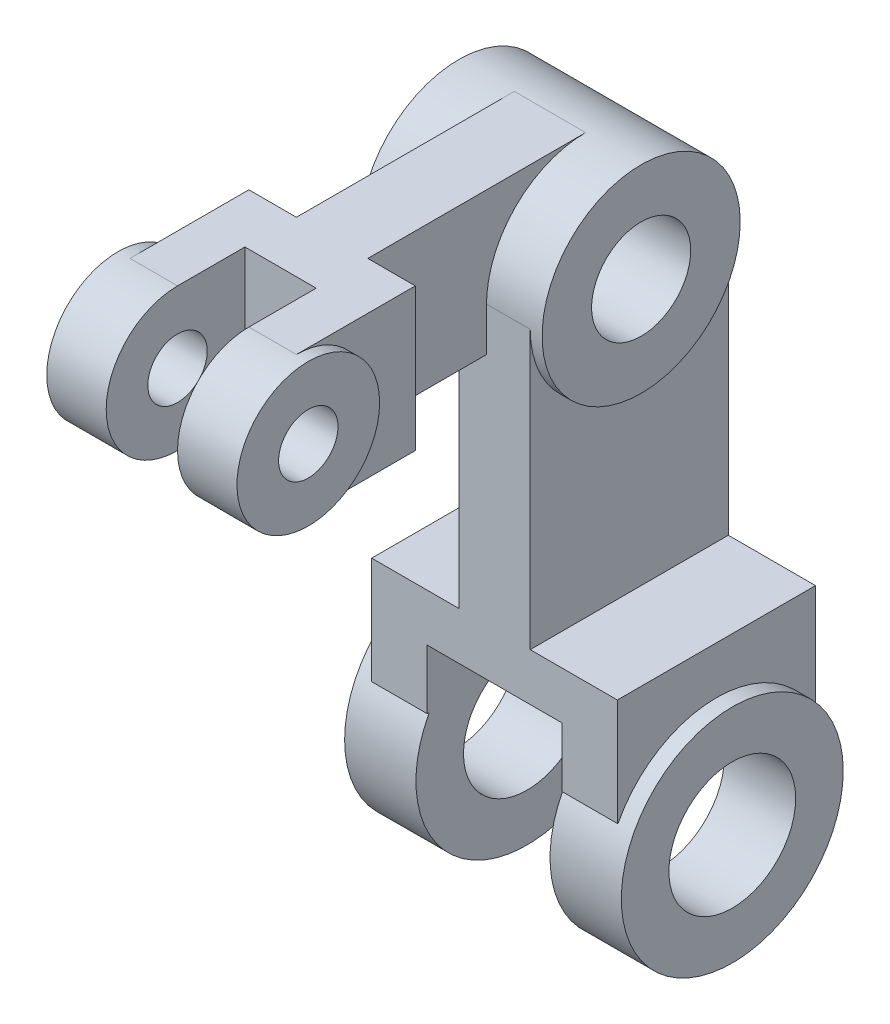
from build123d import *

# Parameters (mm, degrees)
BOSS_EXTRUDE1_DEPTH       = 50
BOSS_EXTRUDE7_START       = 15.277897686
BOSS_EXTRUDE7_OUTLINE_R   = 28
BOSS_EXTRUDE7_OUTLINE_R_2 = 16
BOSS_EXTRUDE7_DEPTH       = 18
CUT_EXTRUDE1_START        = -40
CUT_EXTRUDE1_DEPTH        = 40
BOSS_EXTRUDE8_START       = -36.722102314
BOSS_EXTRUDE8_OUTLINE_R   = 27.997706522
BOSS_EXTRUDE8_OUTLINE_R_2 = 16
BOSS_EXTRUDE8_DEPTH       = 18
CUT_EXTRUDE2_DEPTH        = 20
BOSS_EXTRUDE9_START       = -35.722102314
BOSS_EXTRUDE9_OUTLINE_R   = 25
BOSS_EXTRUDE9_OUTLINE_R_2 = 12.5
BOSS_EXTRUDE9_DEPTH       = 46
CUT_EXTRUDE3_START        = -18
CUT_EXTRUDE3_DEPTH        = 18
BOSS_EXTRUDE10_DEPTH      = 18
BOSS_EXTRUDE11_DEPTH      = 36
BOSS_EXTRUDE12_DEPTH      = 3
BOSS_EXTRUDE12_DEPTH_BACK = 11.999999999999996
SKETCH11_R                = 17.999999999999993
SKETCH11_R_2              = 7.499999999999997
BOSS_EXTRUDE13_DEPTH      = 3
BOSS_EXTRUDE13_DEPTH_BACK = 11.999999999999996
SKETCH12_R                = 18.000000000000018
SKETCH12_R_2              = 7.500000000000014
CUT_EXTRUDE6_DEPTH        = 107.00000000000003


# Read off the part's stored shape, not the designer's step: Boss-Extrude7, Boss-Extrude8, Boss-Extrude9
with BuildPart() as part:
    # Sketch1 → Boss-Extrude1 (new body)
    with BuildSketch(Plane.XY):
        Polygon((-10.722102313940692, 70), (7.2778976860593065, 70), (7.277897686059314, 0), (29.277897686059326, 0), (29.277897686059333, -27), (15.27789768605932, -27), (15.277897686059319, -12), (-18.722102313940685, -12), (-18.722102313940685, -27), (-32.72210231394068, -27), (-32.72210231394068, 0), (-10.722102313940685, 0), align=None)
    extrude(amount=BOSS_EXTRUDE1_DEPTH)

    # Boss-Extrude7 outline → Boss-Extrude7 (add)
    with BuildSketch(Plane.YZ.offset(BOSS_EXTRUDE7_START)):
        with Locations((-40, 25)):
            Circle(BOSS_EXTRUDE7_OUTLINE_R)
        with Locations((-40, 25)):
            Circle(BOSS_EXTRUDE7_OUTLINE_R_2, mode=Mode.SUBTRACT)
    extrude(amount=BOSS_EXTRUDE7_DEPTH)

    # Sketch5 → Cut-Extrude1 (cut)
    with BuildSketch(Plane(origin=(29.277897686059326, 7.52e-15, 0), x_dir=(0, 0, -1), z_dir=(1, 1.3e-16, 0)).offset(CUT_EXTRUDE1_START)):
        with BuildLine():
            Line((-34.32737905308882, -27.000000000000007), (-15.672620946911175, -27.000000000000007))
            ThreePointArc((-15.672620946911175, -27.000000000000007), (-24.999999999999996, -24), (-34.32737905308882, -27.000000000000007))
        make_face()
    extrude(amount=CUT_EXTRUDE1_DEPTH, mode=Mode.SUBTRACT)

    # Boss-Extrude8 outline → Boss-Extrude8 (add)
    with BuildSketch(Plane.YZ.offset(BOSS_EXTRUDE8_START)):
        with Locations((-40.317870429, 24.833627259)):
            Circle(BOSS_EXTRUDE8_OUTLINE_R)
        with Locations((-40.317870429, 24.833627259)):
            Circle(BOSS_EXTRUDE8_OUTLINE_R_2, mode=Mode.SUBTRACT)
    extrude(amount=BOSS_EXTRUDE8_DEPTH)

    # Sketch7 → Cut-Extrude2 (cut)
    with BuildSketch(Plane.ZY.offset(32.72210231394068)):
        with BuildLine():
            Line((15.966027400668322, -27.000000000000004), (33.701227116351625, -27))
            ThreePointArc((33.701227116351625, -27), (24.833627258509974, -24.317870428908922), (15.966027400668322, -27.000000000000004))
        make_face()
    extrude(amount=-CUT_EXTRUDE2_DEPTH, mode=Mode.SUBTRACT)

    # Boss-Extrude9 outline → Boss-Extrude9 (add)
    with BuildSketch(Plane.YZ.offset(BOSS_EXTRUDE9_START)):
        with Locations((70, 25)):
            Circle(BOSS_EXTRUDE9_OUTLINE_R)
        with Locations((70, 25)):
            Circle(BOSS_EXTRUDE9_OUTLINE_R_2, mode=Mode.SUBTRACT)
    extrude(amount=BOSS_EXTRUDE9_DEPTH)

    # Sketch8 → Cut-Extrude3 (cut)
    with BuildSketch(Plane(origin=(7.277897686059314, 7.2e-16, 0), x_dir=(0, 0, -1), z_dir=(1, 1.1e-16, 0)).offset(CUT_EXTRUDE3_START)):
        with BuildLine():
            Line((-37.5, 70), (-12.500000000000004, 70))
            ThreePointArc((-12.500000000000004, 70), (-25, 57.5), (-37.5, 70))
        make_face()
    extrude(amount=CUT_EXTRUDE3_DEPTH, mode=Mode.SUBTRACT)


with BuildPart() as body_2:
    # 3DSketch6 → Boss-Extrude10 (new body)
    with BuildSketch(Plane(origin=(-3.722102313940688, 59.00273717207905, 50.00053283671438), x_dir=(0, 0.7682212795973759, 0.6401843996644798), z_dir=(-1, -1.2e-16, 0))):
        with BuildLine():
            Line((0, 0), (8.450434075571126, 7.042028396309271))
            ThreePointArc((8.450434075571126, 7.042028396309271), (17.343154245651732, 23.984166735180708), (11.651356073893528, 42.25217037785568))
            Line((11.651356073893528, 42.25217037785568), (46.86149805543992, -3.47e-15))
            Line((46.86149805543992, -3.47e-15), (19.205531989934393, -23.046638387921277))
            Line((19.205531989934393, -23.046638387921277), (0, 0))
        make_face()
    extrude(amount=BOSS_EXTRUDE10_DEPTH)

    # 3DSketch7 → Boss-Extrude11 (add)
    with BuildSketch(Plane(origin=(8.27789768605931, 95.00273717207905, 80.00053283671437), x_dir=(-0.8137334712067349, 0, 0.5812381937190965), z_dir=(0, -1, 0))):
        Polygon((0, 0), (17.437145811572893, -24.412004136202047), (27.201947466053713, -17.43714581157289), (17.32089817282907, -3.6036768010583953), (31.9681006545503, 6.858610685885341), (41.84914994777495, -6.974858324629154), (51.61395160225576, 0), (34.17680579068287, 24.412004136202057), align=None)
    extrude(amount=BOSS_EXTRUDE11_DEPTH)

    # Sketch11 → Boss-Extrude12 (add, two sides: drawn at the far end of the back side and taken through both)
    with BuildSketch(Plane(origin=(8.27789768605931, 0, 0), x_dir=(0, 0, -1), z_dir=(1, 0, 0)).offset(-BOSS_EXTRUDE12_DEPTH_BACK)):
        with Locations(Location((-110.00053283671436, 77.00273717207905, 0), (0, 0, 90))):
            Circle(SKETCH11_R)
        with Locations(Location((-110.00053283671436, 77.00273717207905, 0), (0, 0, 270))):
            Circle(SKETCH11_R_2, mode=Mode.SUBTRACT)
    extrude(amount=BOSS_EXTRUDE12_DEPTH + BOSS_EXTRUDE12_DEPTH_BACK)

    # Sketch12 → Boss-Extrude13 (add, two sides: drawn at the far end of the back side and taken through both)
    with BuildSketch(Plane.ZY.offset(33.72210231394072).offset(-BOSS_EXTRUDE13_DEPTH_BACK)):
        with Locations(Location((110.00053283671434, 77.00273717207905, 0), (0, 0, 90))):
            Circle(SKETCH12_R)
        with Locations(Location((110.00053283671434, 77.00273717207905, 0), (0, 0, 270))):
            Circle(SKETCH12_R_2, mode=Mode.SUBTRACT)
    extrude(amount=BOSS_EXTRUDE13_DEPTH + BOSS_EXTRUDE13_DEPTH_BACK)

    # Sketch13 → Cut-Extrude6 (cut)
    with BuildSketch(Plane(origin=(8.27789768605931, 0, 0), x_dir=(0, 0, -1), z_dir=(1, 0, 0))):
        with BuildLine():
            Line((-110.00053283671436, 84.50273717207904), (-110.00053283671437, 69.50273717207905))
            ThreePointArc((-110.00053283671437, 69.50273717207905), (-102.50053283671437, 77.00273717207905), (-110.00053283671436, 84.50273717207904))
        make_face()
    extrude(amount=-CUT_EXTRUDE6_DEPTH, mode=Mode.SUBTRACT)


solid = Compound([part.part, body_2.part])
